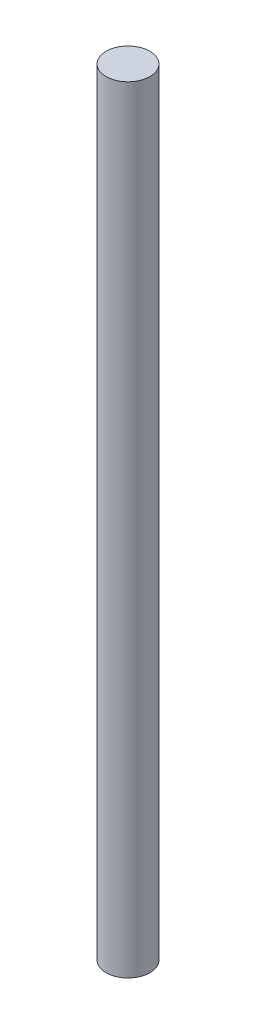
from build123d import *

# Parameters (mm, degrees)
SKETCH_1_R      = 1
EXTRUDE_1_DEPTH = 35.4


with BuildPart() as part:
    # 草图1 → 凸台-拉伸1 (new body)
    with BuildSketch(Plane(origin=(0, 0, 0), x_dir=(1, 0, 0), z_dir=(0, 1, 0))):
        Circle(SKETCH_1_R)
    extrude(amount=EXTRUDE_1_DEPTH)


solid = part.part
